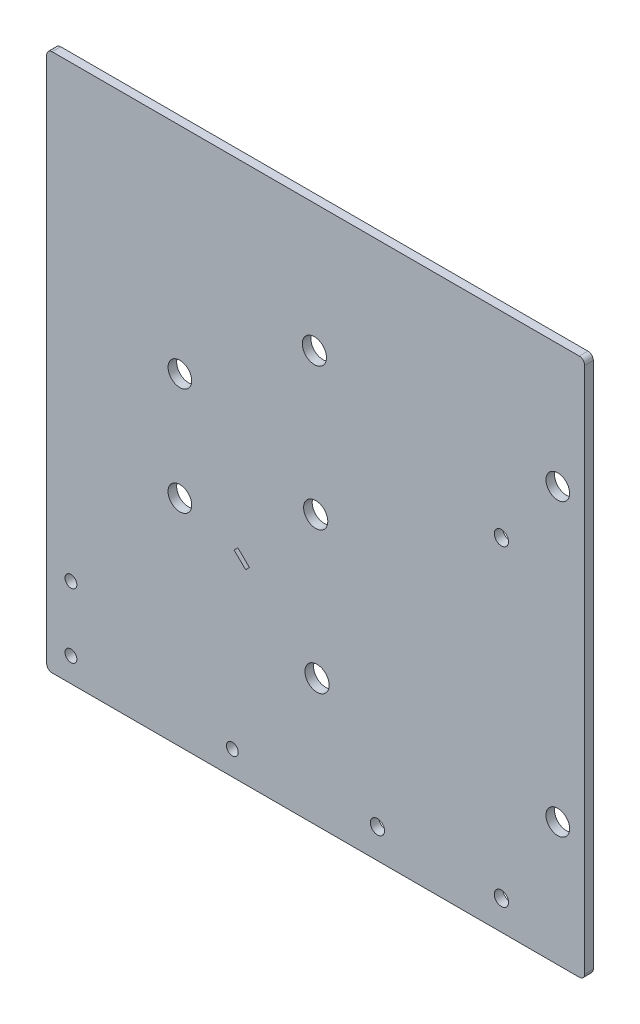
from build123d import *

# Parameters (mm, degrees)
SKETCH1_W           = 100
SKETCH1_H           = 100
BOSS_EXTRUDE1_DEPTH = 1.6
SKETCH3_R           = 2.2479
SKETCH3_R_2         = 1.325
SKETCH3_R_3         = 2.2
SKETCH3_R_4         = 1.1
CUT_EXTRUDE2_DEPTH  = 71.728777736
FILLET1_R           = 1
CUT_EXTRUDE4_DEPTH  = 71.728777736


with BuildPart() as part:
    # Sketch1 → Boss-Extrude1 (new body)
    with BuildSketch(Plane.XY):
        Rectangle(SKETCH1_W, SKETCH1_H)
    extrude(amount=BOSS_EXTRUDE1_DEPTH)

    # Sketch3 → Cut-Extrude2 (cut, through all)
    with BuildSketch(Plane(origin=(0, 0, 1.6), x_dir=(-1, 0, 0), z_dir=(0, 0, -1))):
        with Locations((0.244666378, 26.250570114)):
            Circle(SKETCH3_R)
        Circle(SKETCH3_R)
        with Locations((-34.525, -44.525)):
            Circle(SKETCH3_R_2)
        with Locations((-0.244634233, -26.247149693)):
            Circle(SKETCH3_R)
        with Locations((-45, -27)):
            Circle(SKETCH3_R_3)
        with Locations((-45, 27)):
            Circle(SKETCH3_R_3)
        with Locations((-34.525, 13.525)):
            Circle(SKETCH3_R_2)
        with Locations((15.5, -45.5)):
            Circle(SKETCH3_R_4)
        with Locations((45.5, -45.5)):
            Circle(SKETCH3_R_4)
        with Locations((45.5, -33.5)):
            Circle(SKETCH3_R_4)
        with Locations((-11.475, -44.525)):
            Circle(SKETCH3_R_2)
        with Locations((25.244666378, -9.999429886)):
            Circle(SKETCH3_R_3)
        with Locations((25.244666378, 10.000570114)):
            Circle(SKETCH3_R_3)
    extrude(amount=CUT_EXTRUDE2_DEPTH, mode=Mode.SUBTRACT)

    # Fillet1
    fillet1_edges = [part.edges().sort_by_distance(p)[0] for p in [
        (-50, -50, 0.8),
        (-50, 50, 0.8),
        (50, -50, 0.8),
        (50, 50, 0.8),
    ]]
    fillet(fillet1_edges, radius=FILLET1_R)

    # Sketch5 → Cut-Extrude4 (cut, through all)
    with BuildSketch(Plane(origin=(0, 0, 0), x_dir=(-1, 0, 0), z_dir=(0, 0, -1))):
        Polygon((12.321435303, -14.692994019), (14.462801186, -12.591910452), (15.163162375, -13.30569908), (13.021796492, -15.406782647), align=None)
    extrude(amount=-CUT_EXTRUDE4_DEPTH, mode=Mode.SUBTRACT)


solid = part.part
